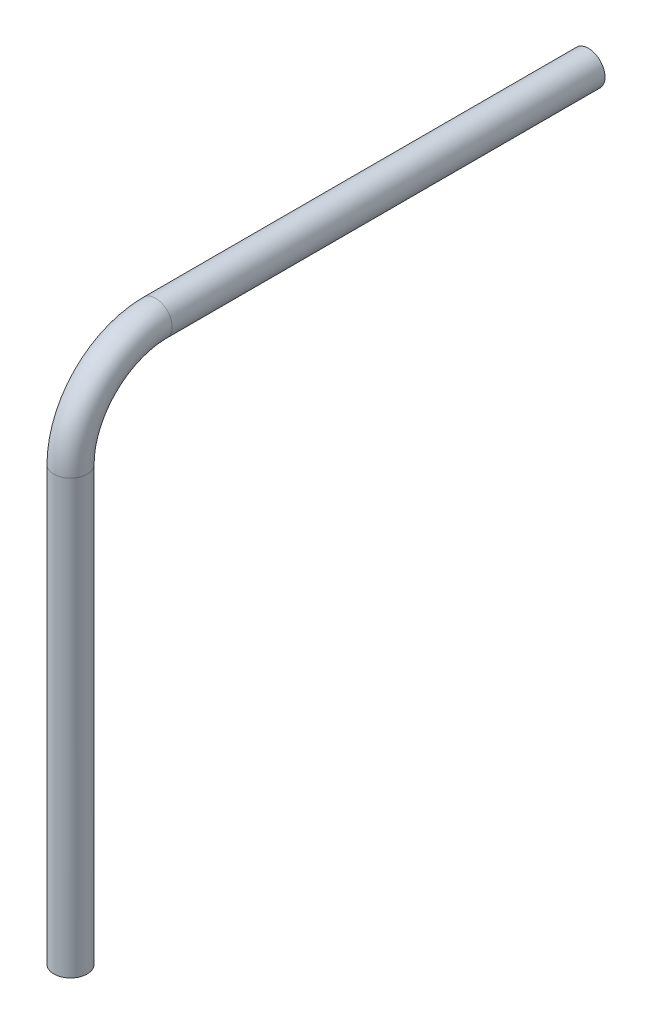
from build123d import *

# Parameters (mm, degrees)
SKETCH3_R           = 12.7
SKETCH4_R           = 12.7
BOSS_EXTRUDE3_DEPTH = 330.2
SKETCH5_R           = 12.7
BOSS_EXTRUDE4_DEPTH = 330.2
SKETCH6_W           = 12.7
SKETCH6_H           = 152.4
CUT_EXTRUDE1_DEPTH  = 6.35


with BuildPart() as part:
    # Sweep1: sweep along a path in Sketch2
    with BuildLine(Plane(origin=(0, 0, 0), x_dir=(0, 0, -1), z_dir=(1, 0, 0))) as sweep1_path:
        ThreePointArc((-64.833774642, 0), (-45.844401699, 45.844401699), (0, 64.833774642))
    # Sketch3 → Sweep1 (sweep)
    with BuildSketch(Plane(origin=(0, 0, 0), x_dir=(1, 0, 0), z_dir=(0, 1, 0))):
        with Locations((0, -64.833774642)):
            Circle(SKETCH3_R)
    sweep(path=sweep1_path.line)

    # Sketch4 → Boss-Extrude3 (add)
    with BuildSketch(Plane(origin=(0, 0, 0), x_dir=(-1, 0, 0), z_dir=(0, -1, 0))):
        with Locations((0, -64.833774642)):
            Circle(SKETCH4_R)
    extrude(amount=BOSS_EXTRUDE3_DEPTH)

    # Sketch5 → Boss-Extrude4 (add)
    with BuildSketch(Plane(origin=(0, 0, 0), x_dir=(-1, 0, 0), z_dir=(0, 0, -1))):
        with Locations((0, 64.833774642)):
            Circle(SKETCH5_R)
    extrude(amount=BOSS_EXTRUDE4_DEPTH)

    # Sketch6 → Cut-Extrude1 (cut)
    with BuildSketch(Plane.ZY.offset(12.7)):
        with Locations((63.5, -76.2)):
            Rectangle(SKETCH6_W, SKETCH6_H)
    extrude(amount=-CUT_EXTRUDE1_DEPTH, mode=Mode.SUBTRACT)


solid = part.part
